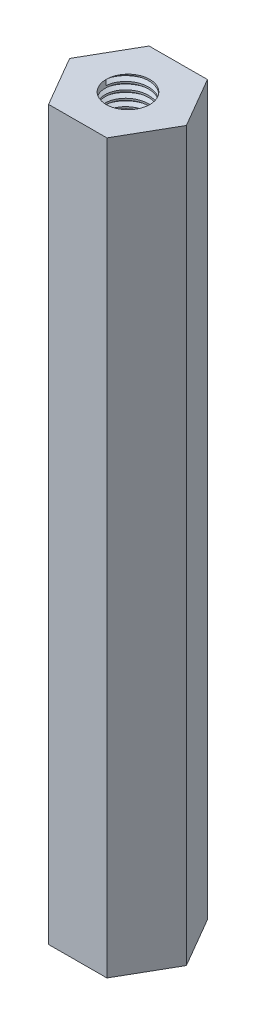
from build123d import *
from build123d.topology import SkipClean

# Parameters (mm, degrees)
EXTRUDE_1_DEPTH     = 50
SKETCH_2_R          = 1.5
CUT_EXTRUDE_1_DEPTH = 10
CUT_EXTRUDE_START   = -10
SKETCH_3_R          = 1.5
CUT_EXTRUDE_2_DEPTH = 10
THREAD_1_PITCH      = 0.5
THREAD_2_PITCH      = 0.5


with BuildPart() as part:
    # Sketch 1 → 凸台-拉伸1 (new body)
    with BuildSketch(Plane(origin=(0, 0, 0), x_dir=(1, 0, 0), z_dir=(0, 1, 0))):
        Polygon((2.009841429, -3.458419663), (4, 0.011363904), (1.990158571, 3.469783567), (-2.009841429, 3.458419663), (-4, -0.011363904), (-1.990158571, -3.469783567), align=None)
    extrude(amount=EXTRUDE_1_DEPTH)

    # Sketch 2 → 切除-拉伸1 (cut)
    with BuildSketch(Plane.XZ):
        with Locations(Location((0, 0, 0), (0, 0, 270))):
            Circle(SKETCH_2_R)
    extrude(amount=-CUT_EXTRUDE_1_DEPTH, mode=Mode.SUBTRACT)

    # 草图3 → 切除-拉伸2 (cut)
    with BuildSketch(Plane(origin=(0, 50, 0), x_dir=(1, 0, 0), z_dir=(0, 1, 0)).offset(CUT_EXTRUDE_START)):
        with Locations(Location((0, 0, 0), (0, 0, 90))):
            Circle(SKETCH_3_R)
    extrude(amount=CUT_EXTRUDE_2_DEPTH, mode=Mode.SUBTRACT)

    # 螺纹线1: the profile of Sketch 1 2 profile screwed along a right-hand helix of 16 turns, 6 arcs to a turn; built about Z, then put on its axis
    with SkipClean():  # the faces are left unmerged after this step: merging them gives an invalid solid
        thread_1_z = Axis((0, 0, 0), (0, 0, 1))
        thread_1_corners = [(1.4997, 0, -0.000173205), (1.770632938, 0, 0.156249999), (1.770632938, 0, 0.218749999), (1.4997, 0, 0.375173204)]
        with BuildLine(mode=Mode.PRIVATE) as thread_1_profile:
            Line(thread_1_corners[0], thread_1_corners[1])
            Line(thread_1_corners[1], thread_1_corners[2])
            Line(thread_1_corners[2], thread_1_corners[3])
            Line(thread_1_corners[3], thread_1_corners[0])
        thread_1_cap = Face(thread_1_profile.wire())
        thread_1_turn_angles = [0, 30, 60, 90, 120, 150, 180, 210, 240, 270, 300, 330, 360]
        thread_1_turn_weights = [1, 0.8660254037844387, 1, 0.8660254037844387, 1, 0.8660254037844387, 1, 0.8660254037844387, 1, 0.8660254037844387, 1, 0.8660254037844387, 1]
        thread_1_turn_rails = [Edge.make_bspline([Vector(p[0], p[1], 0).rotate(thread_1_z, thread_1_turn_angles[k]) / thread_1_turn_weights[k] + Vector(0, 0, p[2] + THREAD_1_PITCH * thread_1_turn_angles[k] / 360) for k in range(13)], [0, 0, 0, 1, 1, 2, 2, 3, 3, 4, 4, 5, 5, 6, 6, 6], 2, thread_1_turn_weights) for p in thread_1_corners]
        thread_1_turn_sides = [Face.make_surface_from_curves(thread_1_turn_rails[p[0]], thread_1_turn_rails[p[1]]) for p in [(0, 1), (1, 2), (2, 3), (3, 0)]]
        thread_1 = Plane(origin=(0, 0, 0), x_dir=(1, 0, 0), z_dir=(0, 1, 0)) * Solid(Shell([*[p.moved(Location((0, 0, THREAD_1_PITCH * i))) for i in range(16) for p in thread_1_turn_sides], thread_1_cap, thread_1_cap.rotate(thread_1_z, 5760).moved(Location((0, 0, THREAD_1_PITCH * 5760 / 360)))]))
        add(thread_1, mode=Mode.SUBTRACT)

    # 螺纹线2: the profile of Sketch 2 2 profile screwed along a right-hand helix of 16 turns, 6 arcs to a turn; built about Z, then put on its axis
    with SkipClean():  # the faces are left unmerged after this step: merging them gives an invalid solid
        thread_2_z = Axis((0, 0, 0), (0, 0, 1))
        thread_2_corners = [(1.4997, 0, -0.000173205), (1.770632938, 0, 0.156249999), (1.770632938, 0, 0.218749999), (1.4997, 0, 0.375173204)]
        with BuildLine(mode=Mode.PRIVATE) as thread_2_profile:
            Line(thread_2_corners[0], thread_2_corners[1])
            Line(thread_2_corners[1], thread_2_corners[2])
            Line(thread_2_corners[2], thread_2_corners[3])
            Line(thread_2_corners[3], thread_2_corners[0])
        thread_2_cap = Face(thread_2_profile.wire())
        thread_2_turn_angles = [0, 30, 60, 90, 120, 150, 180, 210, 240, 270, 300, 330, 360]
        thread_2_turn_weights = [1, 0.8660254037844387, 1, 0.8660254037844387, 1, 0.8660254037844387, 1, 0.8660254037844387, 1, 0.8660254037844387, 1, 0.8660254037844387, 1]
        thread_2_turn_rails = [Edge.make_bspline([Vector(p[0], p[1], 0).rotate(thread_2_z, thread_2_turn_angles[k]) / thread_2_turn_weights[k] + Vector(0, 0, p[2] + THREAD_2_PITCH * thread_2_turn_angles[k] / 360) for k in range(13)], [0, 0, 0, 1, 1, 2, 2, 3, 3, 4, 4, 5, 5, 6, 6, 6], 2, thread_2_turn_weights) for p in thread_2_corners]
        thread_2_turn_sides = [Face.make_surface_from_curves(thread_2_turn_rails[p[0]], thread_2_turn_rails[p[1]]) for p in [(0, 1), (1, 2), (2, 3), (3, 0)]]
        thread_2 = Plane(origin=(0, 50, 0), x_dir=(-1, 0, 0), z_dir=(0, -1, 0)) * Solid(Shell([*[p.moved(Location((0, 0, THREAD_2_PITCH * i))) for i in range(16) for p in thread_2_turn_sides], thread_2_cap, thread_2_cap.rotate(thread_2_z, 5760).moved(Location((0, 0, THREAD_2_PITCH * 5760 / 360)))]))
        add(thread_2, mode=Mode.SUBTRACT)


solid = part.part
